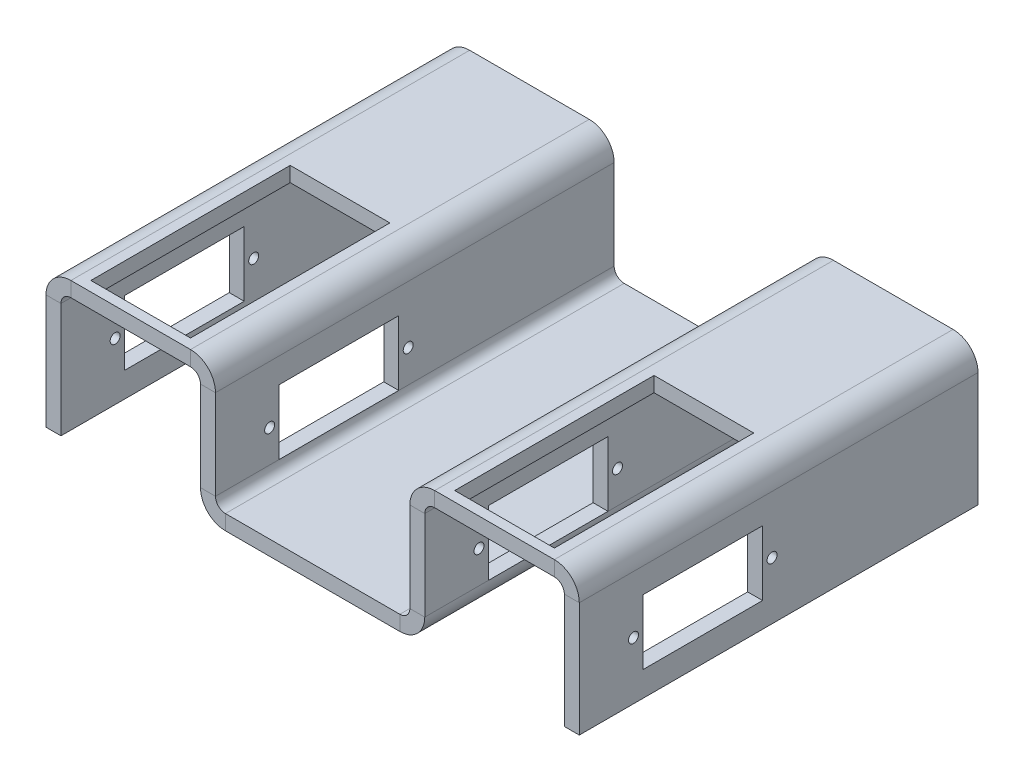
from build123d import *

# Parameters (mm, degrees)
BASE_FLANGE1_DEPTH = 80
SKETCH6_R          = 1
SKETCH6_W          = 24
SKETCH6_H          = 13
CUT_EXTRUDE1_DEPTH = 161.141019336
SKETCH7_W          = 20
SKETCH7_H          = 40
CUT_EXTRUDE2_DEPTH = 10


# Sheet-metal steps are written as plain solids
with BuildPart() as part:
    # Sketch1 → Base-Flange1 (new body)
    with BuildSketch(Plane(origin=(0, 0, 0), x_dir=(1, 0, 0), z_dir=(0, 0, -1))):
        with BuildLine():
            Line((50.5, -60.295787408), (50.5, -83.295787408))
            ThreePointArc((50.5, -83.295787408), (49.914213562, -84.710000971), (48.5, -85.295787408))
            Line((48.5, -85.295787408), (24.5, -85.295787408))
            ThreePointArc((24.5, -85.295787408), (23.085786438, -84.710000971), (22.5, -83.295787408))
            Line((22.5, -83.295787408), (22.5, -65.295787408))
            ThreePointArc((22.5, -65.295787408), (21.035533906, -61.760253502), (17.5, -60.295787408))
            Line((17.5, -60.295787408), (-17.5, -60.295787408))
            ThreePointArc((-17.5, -60.295787408), (-21.035533906, -61.760253502), (-22.5, -65.295787408))
            Line((-22.5, -65.295787408), (-22.5, -83.295787408))
            ThreePointArc((-22.5, -83.295787408), (-23.085786438, -84.710000971), (-24.5, -85.295787408))
            Line((-24.5, -85.295787408), (-48.5, -85.295787408))
            ThreePointArc((-48.5, -85.295787408), (-49.914213562, -84.710000971), (-50.5, -83.295787408))
            Line((-50.5, -83.295787408), (-50.5, -60.295787408))
            Line((-50.5, -60.295787408), (-53.5, -60.295787408))
            Line((-53.5, -60.295787408), (-53.5, -83.295787408))
            ThreePointArc((-53.5, -83.295787408), (-52.035533906, -86.831321314), (-48.5, -88.295787408))
            Line((-48.5, -88.295787408), (-24.5, -88.295787408))
            ThreePointArc((-24.5, -88.295787408), (-20.964466094, -86.831321314), (-19.5, -83.295787408))
            Line((-19.5, -83.295787408), (-19.5, -65.295787408))
            ThreePointArc((-19.5, -65.295787408), (-18.914213562, -63.881573846), (-17.5, -63.295787408))
            Line((-17.5, -63.295787408), (17.5, -63.295787408))
            ThreePointArc((17.5, -63.295787408), (18.914213562, -63.881573846), (19.5, -65.295787408))
            Line((19.5, -65.295787408), (19.5, -83.295787408))
            ThreePointArc((19.5, -83.295787408), (20.964466094, -86.831321314), (24.5, -88.295787408))
            Line((24.5, -88.295787408), (48.5, -88.295787408))
            ThreePointArc((48.5, -88.295787408), (52.035533906, -86.831321314), (53.5, -83.295787408))
            Line((53.5, -83.295787408), (53.5, -60.295787408))
            Line((53.5, -60.295787408), (50.5, -60.295787408))
        make_face()
    extrude(amount=BASE_FLANGE1_DEPTH)

    # Sketch6 → Cut-Extrude1 (cut, through all)
    with BuildSketch(Plane.ZY.offset(53.5)):
        with Locations(Location((-38.674720748, 71.795787408, 0), (0, 0, 90))):
            Circle(SKETCH6_R)
        with Locations(Location((-10.874720748, 71.795787408, 0), (0, 0, 90))):
            Circle(SKETCH6_R)
        with Locations((-24.774720748, 71.795787408)):
            Rectangle(SKETCH6_W, SKETCH6_H)
    extrude(amount=-CUT_EXTRUDE1_DEPTH, mode=Mode.SUBTRACT)

    # Sketch7 → Cut-Extrude2 (cut)
    with BuildSketch(Plane(origin=(0, 88.295787408, 0), x_dir=(1, 0, 0), z_dir=(0, 1, 0))):
        with Locations((-36.5, 22)):
            Rectangle(SKETCH7_W, SKETCH7_H)
        with Locations((36.5, 22)):
            Rectangle(SKETCH7_W, SKETCH7_H)
    extrude(amount=-CUT_EXTRUDE2_DEPTH, mode=Mode.SUBTRACT)


solid = part.part
